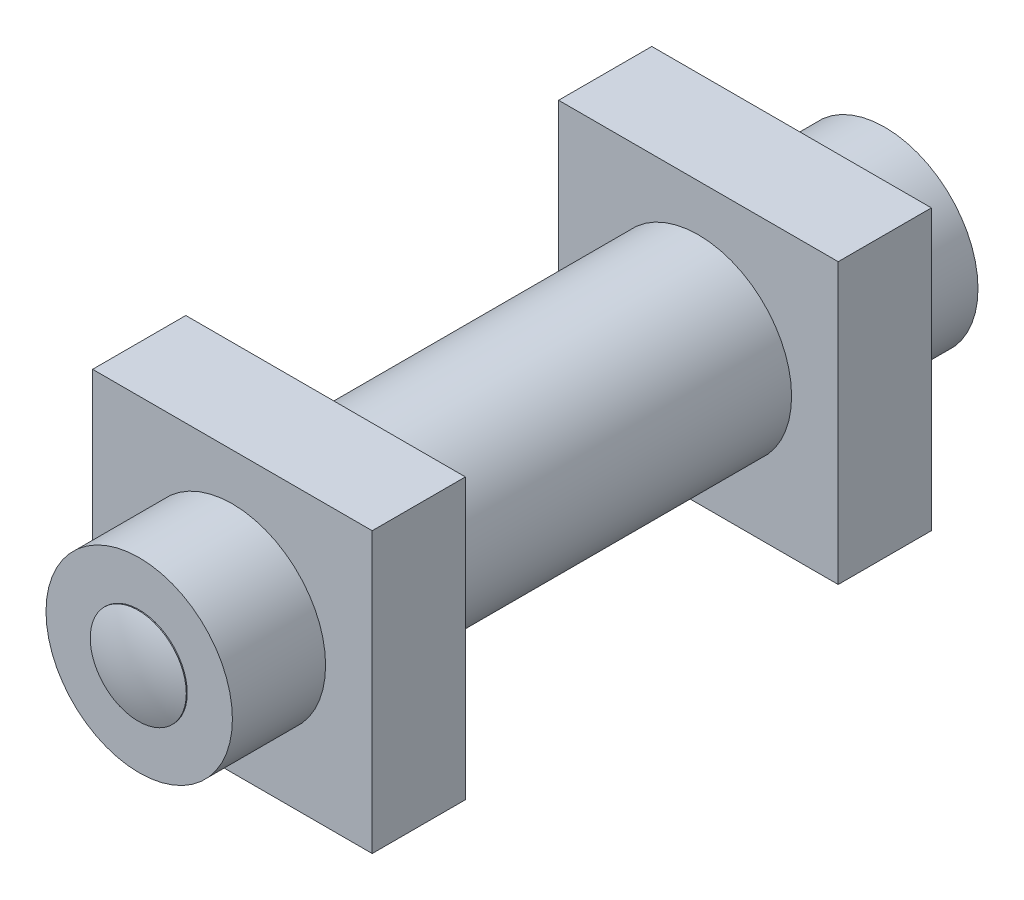
from build123d import *

# Parameters (mm, degrees)
SKETCH1_R           = 25.4
BOSS_EXTRUDE1_DEPTH = 101.6
SKETCH8_W           = 25.4
SKETCH8_H           = 76.2
BOSS_EXTRUDE2_DEPTH = 76.2
SKETCH9_R           = 13.092802434
BOSS_EXTRUDE3_DEPTH = 0.254
DOME1_FACE_RADIUS   = 13.092802434
DOME1_HEIGHT        = 2.38
SKETCH10_R          = 12.541774092
BOSS_EXTRUDE4_DEPTH = 0.254


# Read off the part's stored shape, not the designer's step: Dome2
with BuildPart() as part:
    # Sketch1 → Boss-Extrude1 (new, symmetric)
    with BuildSketch(Plane.XY):
        Circle(SKETCH1_R)
    extrude(amount=BOSS_EXTRUDE1_DEPTH, both=True)

    # Sketch8 → Boss-Extrude2 (add)
    with BuildSketch(Plane(origin=(38.1, 0, 0), x_dir=(0, 0, -1), z_dir=(1, 0, 0))):
        with Locations((-63.5, 0)):
            Rectangle(SKETCH8_W, SKETCH8_H)
    extrude(amount=-BOSS_EXTRUDE2_DEPTH)

    # Mirror1: part across plane


with BuildPart() as part_1:
    add(part.part)
    add(part.part.mirror(Plane.XY))

    # Sketch9 → Boss-Extrude3 (add)
    with BuildSketch(Plane.XY.offset(101.6)):
        Circle(SKETCH9_R)
    extrude(amount=BOSS_EXTRUDE3_DEPTH)

    # Dome1: a dome of height H over a round flat face of radius A is a cap of a sphere of radius (A * A + H * H) / (2 * H)
    dome1_r = (DOME1_FACE_RADIUS * DOME1_FACE_RADIUS + DOME1_HEIGHT * DOME1_HEIGHT) / (2 * DOME1_HEIGHT)
    dome1_base = Plane((0, 0, 101.854), z_dir=(0, 0, 1))
    with Locations(dome1_base.offset(DOME1_HEIGHT - dome1_r)):
        dome1_ball = Sphere(dome1_r, mode=Mode.PRIVATE)
    add(split(dome1_ball, bisect_by=dome1_base, keep=Keep.TOP, mode=Mode.PRIVATE))

    # Sketch10 → Boss-Extrude4 (add)
    with BuildSketch(Plane(origin=(0, 0, -101.6), x_dir=(-1, 0, 0), z_dir=(0, 0, -1))):
        Circle(SKETCH10_R)
    extrude(amount=BOSS_EXTRUDE4_DEPTH)

    # Dome2 outline → Dome2 (revolve)
    with BuildSketch(Plane.XZ):
        with BuildLine():
            Line((0, -101.853999987), (0, -104.234))
            ThreePointArc((0, -104.234), (6.382799116, -103.633737683), (12.541774124, -101.853999987))
            Line((12.541774124, -101.853999987), (0, -101.853999987))
        make_face()
    revolve(axis=Axis((0, 0, 0), (0, 0, 1)))


solid = part_1.part
